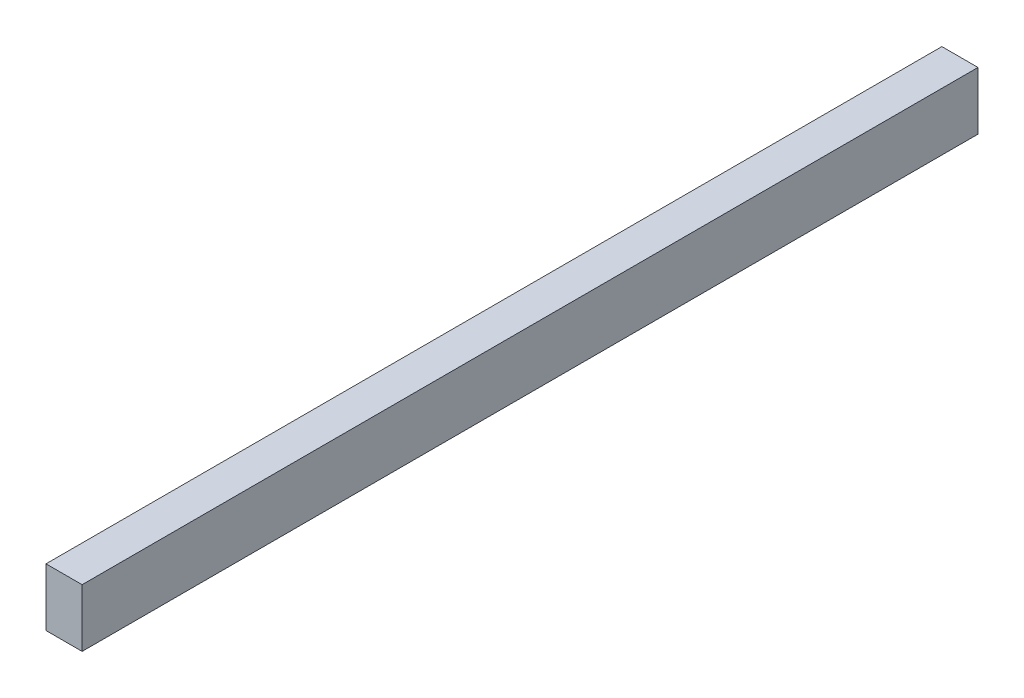
from build123d import *

# Parameters (mm, degrees)
ESQUISSE1_W        = 25
ESQUISSE1_H        = 40
BOSS_EXTRU_1_DEPTH = 620


with BuildPart() as part:
    # Esquisse1 → Boss.-Extru.1 (new body)
    with BuildSketch(Plane.XY):
        with Locations((12.5, 20)):
            Rectangle(ESQUISSE1_W, ESQUISSE1_H)
    extrude(amount=BOSS_EXTRU_1_DEPTH)


solid = part.part
